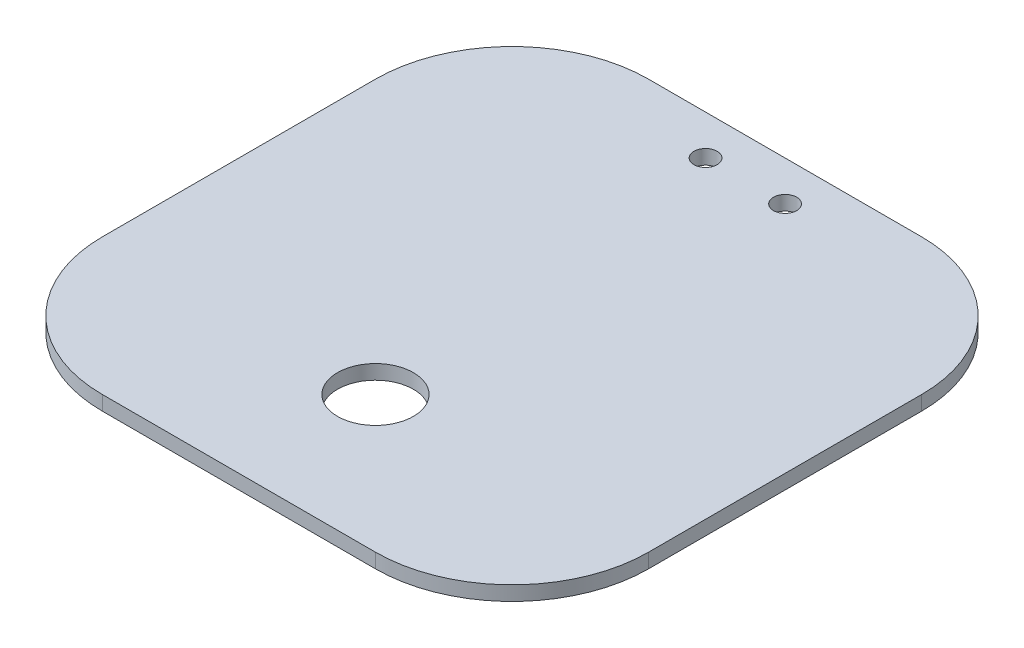
from build123d import *

# Parameters (mm, degrees)
BOSS_EXTRUDE1_DEPTH         = 3.175
F_10_CLEARANCE_HOLE1_D      = 5.1054
F_5_8_CLEARANCE_HOLE1_D     = 16.66748
F_5_8_CLEARANCE_HOLE1_DEPTH = 6.89
F_5_8_CLEARANCE_HOLE1_TIP   = 5.007416175


with BuildPart() as part:
    # Sketch1 → Boss-Extrude1 (new body)
    with BuildSketch(Plane(origin=(0, 0, 0), x_dir=(1, 0, 0), z_dir=(0, 1, 0))):
        with BuildLine():
            Line((-30, 60), (30, 60))
            ThreePointArc((30, 60), (51.213203436, 51.213203436), (60, 30))
            Line((60, 30), (60, -30))
            ThreePointArc((60, -30), (51.213203436, -51.213203436), (30, -60))
            Line((30, -60), (-30, -60))
            ThreePointArc((-30, -60), (-51.213203436, -51.213203436), (-60, -30))
            Line((-60, -30), (-60, 30))
            ThreePointArc((-60, 30), (-51.213203436, 51.213203436), (-30, 60))
        make_face()
    extrude(amount=BOSS_EXTRUDE1_DEPTH)

    # #10 Clearance Hole1 (through all)
    with Locations(Plane(origin=(0, 3.175, 0), x_dir=(1, 0, 0), z_dir=(0, 1, 0))):
        with Locations((8.7376, 51.2624), (-8.7376, 51.2624)):
            Hole(F_10_CLEARANCE_HOLE1_D / 2)

    # 5/8 Clearance Hole1
    with Locations(Plane(origin=(0, 3.175, 0), x_dir=(1, 0, 0), z_dir=(0, 1, 0))):
        with Locations((0, -30)):
            Hole(F_5_8_CLEARANCE_HOLE1_D / 2, depth=F_5_8_CLEARANCE_HOLE1_DEPTH)
            with Locations((0, 0, -(F_5_8_CLEARANCE_HOLE1_DEPTH + F_5_8_CLEARANCE_HOLE1_TIP / 2))):  # 118° drill point
                Cone(0, F_5_8_CLEARANCE_HOLE1_D / 2, F_5_8_CLEARANCE_HOLE1_TIP, mode=Mode.SUBTRACT)


solid = part.part
